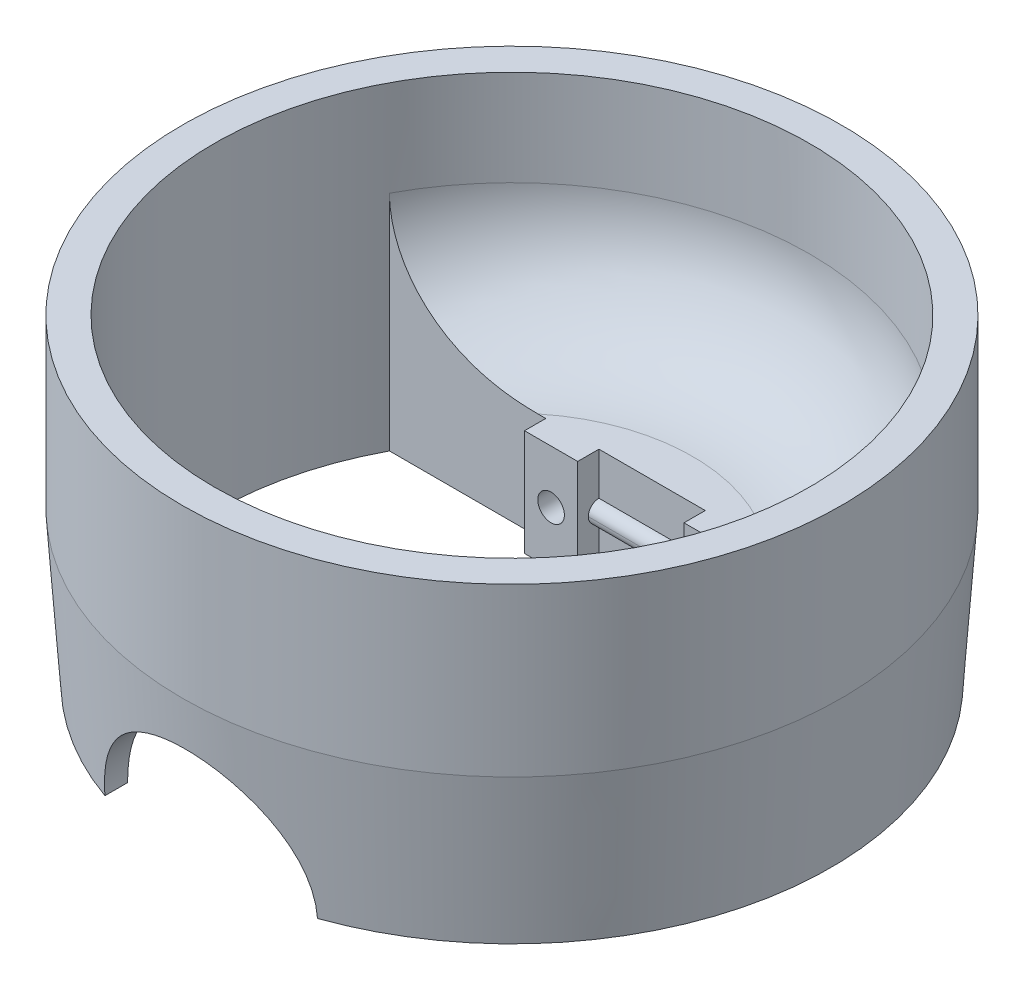
from build123d import *

# Parameters (mm, degrees)
SKETCH1_R           = 31
SKETCH1_R_2         = 28
BOSS_EXTRUDE1_DEPTH = 30
BOSS_EXTRUDE2_START = -10
BOSS_EXTRUDE2_DEPTH = 10
CUT_EXTRUDE1_DEPTH  = 51
SKETCH4_W           = 5
SKETCH4_H           = 10
SKETCH4_R           = 1.25
BOSS_EXTRUDE3_DEPTH = 2
SKETCH4_3_W         = 10
SKETCH4_3_H         = 2
BOSS_EXTRUDE4_DEPTH = 1
CUT_EXTRUDE2_START  = -6
SKETCH4_4_R         = 1.25
CUT_EXTRUDE2_DEPTH  = 6
FILLET1_R           = 1
FILLET3_R           = 11


with BuildPart() as part:
    # Sketch1 → Boss-Extrude1 (new body)
    with BuildSketch(Plane(origin=(0, 0, 0), x_dir=(1, 0, 0), z_dir=(0, 1, 0))):
        with Locations(Location((0, 0, 0), (0, 0, 270))):
            Circle(SKETCH1_R)
        with Locations(Location((0, 0, 0), (0, 0, 270))):
            Circle(SKETCH1_R_2, mode=Mode.SUBTRACT)
    extrude(amount=-BOSS_EXTRUDE1_DEPTH)

    # Sketch2 → Boss-Extrude2 (add)
    with BuildSketch(Plane.XZ.offset(30).offset(BOSS_EXTRUDE2_START)):
        with BuildLine():
            Line((-24.701905706, -13.183924092), (24.701905706, -13.183924092))
            ThreePointArc((24.701905706, -13.183924092), (0, -28), (-24.701905706, -13.183924092))
        make_face()
    extrude(amount=BOSS_EXTRUDE2_DEPTH)

    # Sketch3 → Cut-Extrude1 (cut)
    with BuildSketch(Plane.XY.offset(-13.183924092)):
        with BuildLine():
            Line((-10, -30), (10, -30))
            ThreePointArc((10, -30), (0, -20), (-10, -30))
        make_face()
    extrude(amount=CUT_EXTRUDE1_DEPTH, mode=Mode.SUBTRACT)

    # Sketch4 → Boss-Extrude3 (add)
    # profile 1 of 2: a face of its own
    with BuildSketch(Plane.XY.offset(-13.183924092)):
        with Locations((-7.5, -25)):
            Rectangle(SKETCH4_W, SKETCH4_H)
        with Locations((-7.5, -25)):
            Circle(SKETCH4_R, mode=Mode.SUBTRACT)
    # profile 2 of 2: a face of its own
    with BuildSketch(Plane.XY.offset(-13.183924092)):
        with Locations((7.5, -25)):
            Rectangle(SKETCH4_W, SKETCH4_H)
        with Locations((7.5, -25)):
            Circle(SKETCH4_R, mode=Mode.SUBTRACT)
    extrude(amount=BOSS_EXTRUDE3_DEPTH)

    # Sketch4<3> → Boss-Extrude4 (add)
    with BuildSketch(Plane.XY.offset(-13.183924092)):
        with Locations((0, -25)):
            Rectangle(SKETCH4_3_W, SKETCH4_3_H)
    extrude(amount=BOSS_EXTRUDE4_DEPTH)

    # Sketch4<4> → Cut-Extrude2 (cut)
    with BuildSketch(Plane.XY.offset(-13.183924092).offset(CUT_EXTRUDE2_START)):
        with Locations((-7.5, -25)):
            Circle(SKETCH4_4_R)
        with Locations((7.5, -25)):
            Circle(SKETCH4_4_R)
    extrude(amount=CUT_EXTRUDE2_DEPTH, mode=Mode.SUBTRACT)

    # Fillet1
    fillet1_edges = [part.edges().sort_by_distance(p)[0] for p in [
        (0, -24, -12.183924092),
        (0, -26, -12.183924092),
    ]]
    fillet(fillet1_edges, radius=FILLET1_R - 0.0001)  # a hair under: the kernel refuses the full size

    # Chamfer1: read off the stored shape, not the designer's step
    # Chamfer1 outline → Chamfer1 (revolve, cut)
    with BuildSketch(Plane.XY):
        Polygon((31, -15.699333743), (30, -30), (31, -30), align=None)
    revolve(axis=Axis((0, 0, 0), (0, 1, 0)), mode=Mode.SUBTRACT)

    # Fillet3
    fillet3_edges = [part.edges().sort_by_distance(p)[0] for p in [
        (0, -20, -28),
    ]]
    fillet(fillet3_edges, radius=FILLET3_R)


solid = part.part
